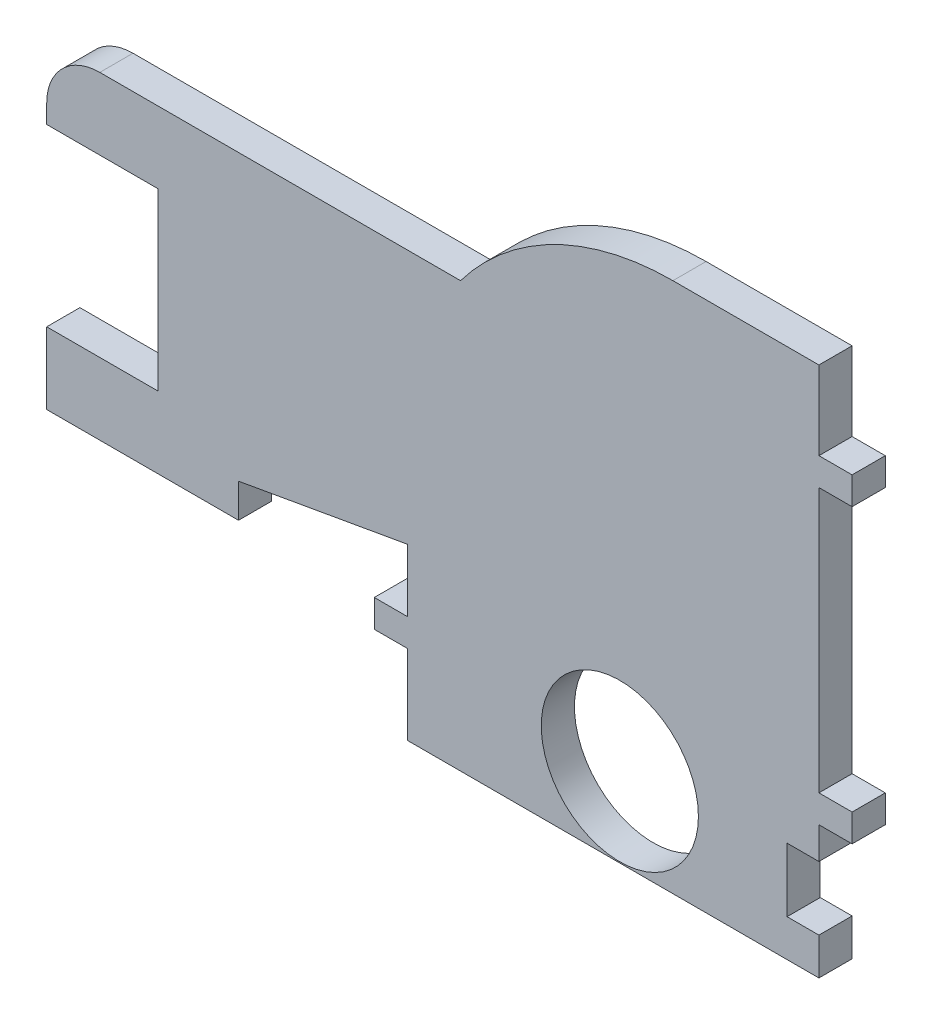
from build123d import *

# Parameters (mm, degrees)
SKETCH1_R           = 3.7592
BOSS_EXTRUDE1_DEPTH = 1.5875


with BuildPart() as part:
    # Sketch1 → Boss-Extrude1 (new body)
    with BuildSketch(Plane.XY):
        with BuildLine():
            Line((-18.241771939, 2.890724209), (-10.16, 4.318))
            Line((-10.16, 4.318), (-10.16, 1.3208))
            Line((-10.16, 1.3208), (-11.7475, 1.3208))
            Line((-11.7475, 1.3208), (-11.7475, 0))
            Line((-11.7475, 0), (-10.16, 0))
            Line((-10.16, 0), (-10.16, -3.81))
            Line((-10.16, -3.81), (9.525, -3.81))
            Line((9.525, -3.81), (9.525, -2.032))
            Line((9.525, -2.032), (8.001, -2.032))
            Line((8.001, -2.032), (8.001, 1.016))
            Line((8.001, 1.016), (9.525, 1.016))
            Line((9.525, 1.016), (9.525, 2.54))
            Line((9.525, 2.54), (11.1125, 2.54))
            Line((11.1125, 2.54), (11.1125, 3.8608))
            Line((11.1125, 3.8608), (9.525, 3.8608))
            Line((9.525, 3.8608), (9.525, 16.51))
            Line((9.525, 16.51), (11.1125, 16.51))
            Line((11.1125, 16.51), (11.1125, 17.8308))
            Line((11.1125, 17.8308), (9.525, 17.8308))
            Line((9.525, 17.8308), (9.525, 21.59))
            Line((9.525, 21.59), (2.54, 21.59))
            ThreePointArc((2.54, 21.59), (-3.139612663, 20.249225326), (-7.62, 16.51))
            Line((-7.62, 16.51), (-24.878921519, 16.51))
            ThreePointArc((-24.878921519, 16.51), (-26.674972743, 15.766051224), (-27.418921519, 13.97))
            Line((-27.418921519, 13.97), (-27.418921519, 13.081))
            Line((-27.418921519, 13.081), (-22.084921519, 13.081))
            Line((-22.084921519, 13.081), (-22.084921519, 4.699))
            Line((-22.084921519, 4.699), (-27.418921519, 4.699))
            Line((-27.418921519, 4.699), (-27.418921519, 1.27))
            Line((-27.418921519, 1.27), (-18.241771939, 1.27))
            Line((-18.241771939, 1.27), (-18.241771939, 2.890724209))
        make_face()
        Circle(SKETCH1_R, mode=Mode.SUBTRACT)
    extrude(amount=BOSS_EXTRUDE1_DEPTH)


solid = part.part
